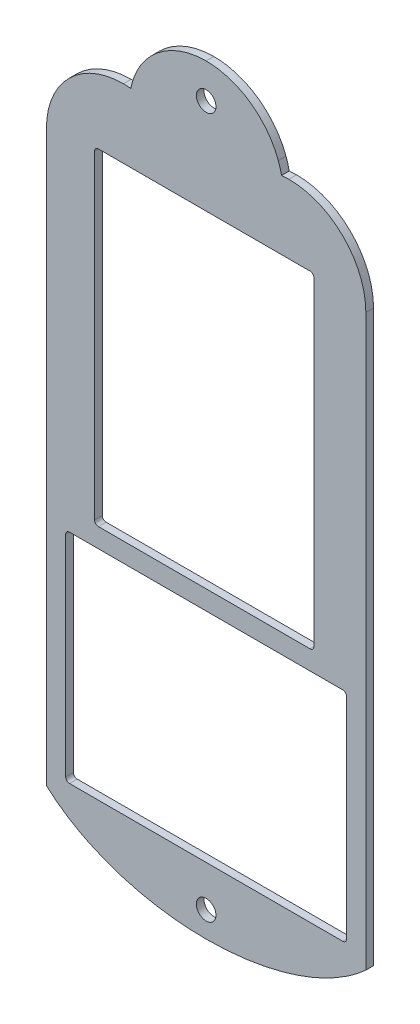
from build123d import *

# Parameters (mm, degrees)
SKETCH_1_R      = 2.55
EXTRUDE_1_DEPTH = 2


with BuildPart() as part:
    # 草图1 → 凸台-拉伸1 (new body)
    with BuildSketch(Plane.XY):
        with BuildLine():
            Line((-84.749966119, 68.150894314), (-84.749966119, -79.849105686))
            add(Edge.make_bspline(
                [(-84.749966119, -79.849105686), (-81.638463536, -82.692493713), (-77.817874174, -85.197228854), (-73.446952341, -87.268032686)],
                knots=[11, 11, 11, 11, 12, 12, 12, 12], degree=3))
            add(Edge.make_bspline(
                [(-73.446952341, -87.268032686), (-65.029679733, -91.257948491), (-54.573341235, -93.618032685), (-43.249183184, -93.618032685)],
                knots=[12, 12, 12, 12, 13, 13, 13, 13], degree=3))
            add(Edge.make_bspline(
                [(-43.249183184, -93.618032685), (-31.925025133, -93.618032685), (-21.468686634, -91.257948491), (-13.051414026, -87.268032686)],
                knots=[13, 13, 13, 13, 14, 14, 14, 14], degree=3))
            add(Edge.make_bspline(
                [(-13.051414026, -87.268032686), (-8.680492193, -85.197228854), (-4.859902832, -82.692493713), (-1.748400249, -79.849105686)],
                knots=[14, 14, 14, 14, 15, 15, 15, 15], degree=3))
            Line((-1.748400249, -79.849105686), (-1.748400249, 68.150894314))
            add(Edge.make_bspline(
                [(-1.748400249, 68.150894314), (-1.748400249, 79.196365672), (-10.701901969, 88.149867392), (-21.747373327, 88.149867392)],
                knots=[0, 0, 0, 0, 1, 1, 1, 1], degree=3))
            add(Edge.make_bspline(
                [(-21.747373327, 88.149867392), (-22.389431466, 88.149867392), (-23.027958383, 88.11812945), (-23.655913162, 88.058141725)],
                knots=[1, 1, 1, 1, 2, 2, 2, 2], degree=3))
            add(Edge.make_bspline(
                [(-23.655913162, 88.058141725), (-23.86050877, 89.056508865), (-24.142748218, 90.030178976), (-24.48846355, 90.972089614)],
                knots=[2, 2, 2, 2, 3, 3, 3, 3], degree=3))
            add(Edge.make_bspline(
                [(-24.48846355, 90.972089614), (-27.310685771, 98.592102531), (-34.644928018, 104.024867388), (-43.249183184, 104.024867388)],
                knots=[3, 3, 3, 3, 4, 4, 4, 4], degree=3))
            add(Edge.make_bspline(
                [(-43.249183184, 104.024867388), (-51.853438349, 104.024867388), (-59.187680596, 98.592102531), (-62.009902817, 90.972089614)],
                knots=[4, 4, 4, 4, 5, 5, 5, 5], degree=3))
            add(Edge.make_bspline(
                [(-62.009902817, 90.972089614), (-62.355639681, 90.030178976), (-62.637857597, 89.056508865), (-62.842453205, 88.058141725)],
                knots=[5, 5, 5, 5, 6, 6, 6, 6], degree=3))
            add(Edge.make_bspline(
                [(-62.842453205, 88.058141725), (-63.470407985, 88.11812945), (-64.105403678, 88.149867392), (-64.747461817, 88.149867392)],
                knots=[6, 6, 6, 6, 7, 7, 7, 7], degree=3))
            add(Edge.make_bspline(
                [(-64.747461817, 88.149867392), (-75.796464398, 88.149867392), (-84.749966119, 79.196365672), (-84.749966119, 68.150894314)],
                knots=[7, 7, 7, 7, 8, 8, 8, 8], degree=3))
        make_face()
        with Locations((-43.249183184, 95.010103095)):
            Circle(SKETCH_1_R, mode=Mode.SUBTRACT)
        with Locations((-43.249183184, -86.989896905)):
            Circle(SKETCH_1_R, mode=Mode.SUBTRACT)
        with BuildLine():
            Line((-71.249966119, 70.224867388), (-16.248400249, 70.224867388))
            ThreePointArc((-16.248400249, 70.224867388), (-15.541293467, 69.931974169), (-15.248400249, 69.224867388))
            Line((-15.248400249, 69.224867388), (-15.248400249, -13.775132612))
            ThreePointArc((-15.248400249, -13.775132612), (-15.541293467, -14.482239393), (-16.248400249, -14.775132612))
            Line((-16.248400249, -14.775132612), (-71.249966119, -14.775132612))
            ThreePointArc((-71.249966119, -14.775132612), (-71.9570729, -14.482239393), (-72.249966119, -13.775132612))
            Line((-72.249966119, -13.775132612), (-72.249966119, 69.224867388))
            ThreePointArc((-72.249966119, 69.224867388), (-71.9570729, 69.931974169), (-71.249966119, 70.224867388))
        make_face(mode=Mode.SUBTRACT)
        with BuildLine():
            Line((-78.749966119, -19.775132612), (-7.748400249, -19.775132612))
            ThreePointArc((-7.748400249, -19.775132612), (-7.041293467, -20.068025831), (-6.748400249, -20.775132612))
            Line((-6.748400249, -20.775132612), (-6.748400249, -75.349105686))
            ThreePointArc((-6.748400249, -75.349105686), (-7.041293467, -76.056212467), (-7.748400249, -76.349105686))
            Line((-7.748400249, -76.349105686), (-78.749966119, -76.349105686))
            ThreePointArc((-78.749966119, -76.349105686), (-79.4570729, -76.056212467), (-79.749966119, -75.349105686))
            Line((-79.749966119, -75.349105686), (-79.749966119, -20.775132612))
            ThreePointArc((-79.749966119, -20.775132612), (-79.4570729, -20.068025831), (-78.749966119, -19.775132612))
        make_face(mode=Mode.SUBTRACT)
    extrude(amount=EXTRUDE_1_DEPTH)


solid = part.part
